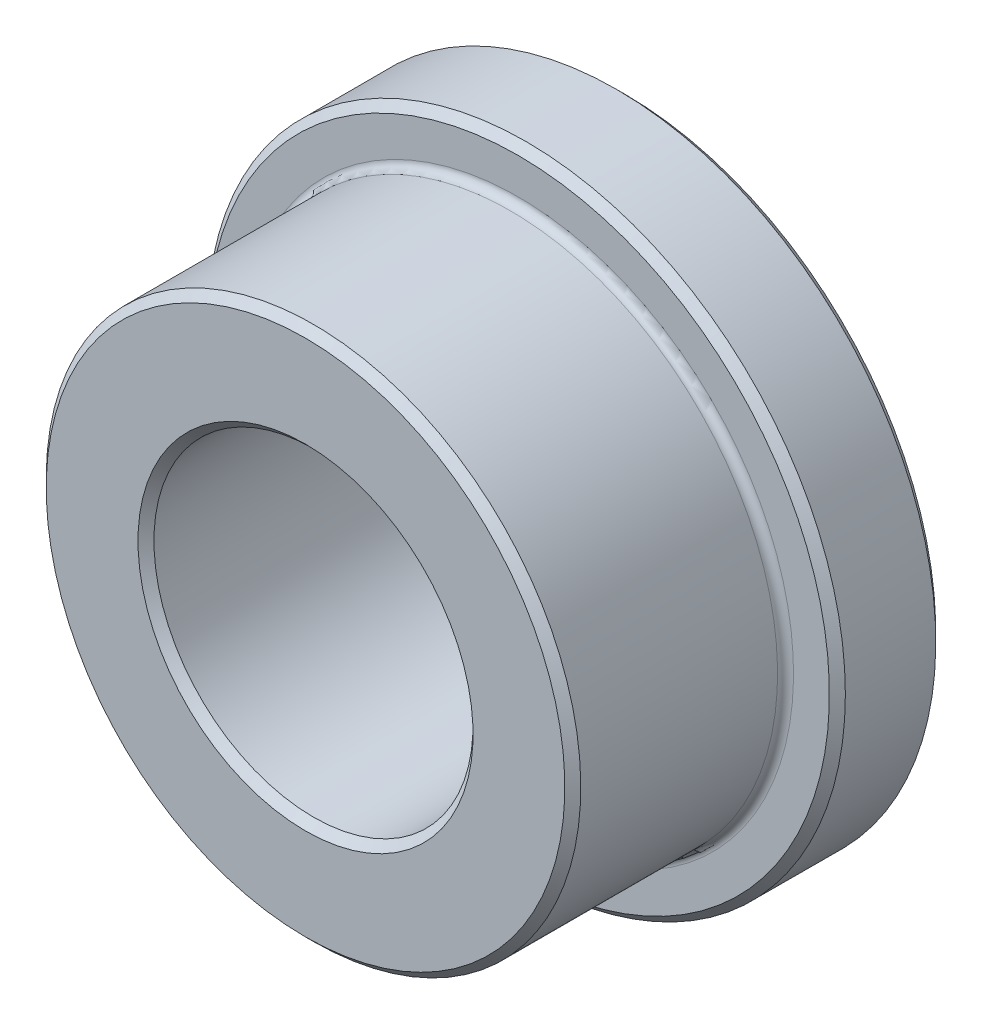
from build123d import *

# Parameters (mm, degrees)
CHAMFER1_SIZE = 0.15
FILLET1_R     = 0.15


with BuildPart() as part:
    # Sketch3 → Revolve1 (revolve)
    with BuildSketch(Plane(origin=(0, 0, 0), x_dir=(0, 0, -1), z_dir=(1, 0, 0))):
        Polygon((3, 6), (1, 6), (1, 5.0255), (-3, 5.0255), (-3, 3), (3, 3), align=None)
    revolve(axis=Axis((0, 0, -3), (0, 0, 1)))

    # Chamfer1
    chamfer1_edges = [part.edges().sort_by_distance(p)[0] for p in [
        (0, -6, -3),
        (0, -6, -1),
        (0, -5.0255, 3),
        (0, -3, 3),
    ]]
    chamfer(chamfer1_edges, length=CHAMFER1_SIZE)

    # Fillet1
    fillet1_edges = [part.edges().sort_by_distance(p)[0] for p in [
        (0, -5.0255, -1),
    ]]
    fillet(fillet1_edges, radius=FILLET1_R)


solid = part.part
